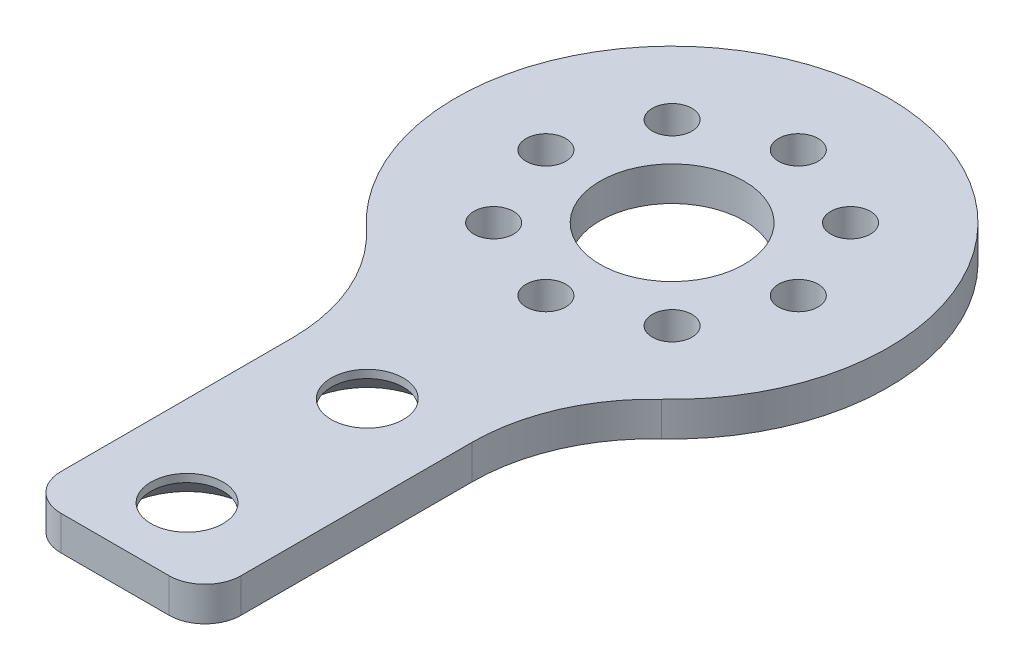
from build123d import *

# Parameters (mm, degrees)
BOSS_EXTRUDE1_DEPTH                            = 4.7625
M5_CLEARANCE_HOLE1_D                           = 5.5
M5_CLEARANCE_HOLE1_CSINK_D                     = 5.55
M5_CLEARANCE_HOLE1_CSINK_ANGLE                 = 90
SKETCH5_R                                      = 10
CUT_EXTRUDE1_DEPTH                             = 84.027763037
CSK_FOR_M8_FLAT_HEAD_MACHINE_SCREW1_AT_2_COUNT = 2
CSK_FOR_M8_FLAT_HEAD_MACHINE_SCREW1_AT_2_PITCH = 25
FILLET1_R                                      = 25
FILLET2_R                                      = 5


with BuildPart() as part:
    # Sketch1 → Boss-Extrude1 (new body)
    with BuildSketch(Plane(origin=(0, 0, 0), x_dir=(1, 0, 0), z_dir=(0, 1, 0))):
        with BuildLine():
            Line((-12.5, -77.271780287), (12.5, -77.271780287))
            Line((12.5, -77.271780287), (12.5, -27.271780287))
            ThreePointArc((12.5, -27.271780287), (0, 30), (-12.5, -27.271780287))
            Line((-12.5, -27.271780287), (-12.5, -77.271780287))
        make_face()
    extrude(amount=BOSS_EXTRUDE1_DEPTH)

    # M5 Clearance Hole1 (through all)
    with Locations(Plane(origin=(0, 0, 0), x_dir=(-1, 0, 0), z_dir=(0, -1, 0))):
        with Locations((0, 17.5), (12.374368671, 12.374368671), (17.5, 0), (12.374368671, -12.374368671), (0, -17.5), (-12.374368671, -12.374368671), (-17.5, 0), (-12.374368671, 12.374368671)):
            CounterSinkHole(M5_CLEARANCE_HOLE1_D / 2, M5_CLEARANCE_HOLE1_CSINK_D / 2, counter_sink_angle=M5_CLEARANCE_HOLE1_CSINK_ANGLE)

    # Sketch5 → Cut-Extrude1 (cut, through all)
    with BuildSketch(Plane.XZ):
        Circle(SKETCH5_R)
    extrude(amount=-CUT_EXTRUDE1_DEPTH, mode=Mode.SUBTRACT)

    # Sketch8 → CSK for M8 Flat Head Machine Screw1 (revolve, cut)
    with BuildSketch(Plane(origin=(0, 0, 42.271780287), x_dir=(0, 0, -1), z_dir=(1, 0, 0))):
        Polygon((0, 0), (0, 4.7625), (5, 4.7625), (5, 3.65), (8.65, 0), align=None)
    csk_for_m8_flat_head_machine_screw1 = revolve(axis=Axis((0, -6.35, 42.271780287), (0, 1, 0)), mode=Mode.SUBTRACT)

    # CSK for M8 Flat Head Machine Screw1 at 2: CSK for M8 Flat Head Machine Screw1 ×2
    with Locations(*[(0, 0, i * CSK_FOR_M8_FLAT_HEAD_MACHINE_SCREW1_AT_2_PITCH) for i in range(1, CSK_FOR_M8_FLAT_HEAD_MACHINE_SCREW1_AT_2_COUNT)]):
        add(csk_for_m8_flat_head_machine_screw1, mode=Mode.SUBTRACT)

    # Fillet1
    fillet1_edges = [part.edges().sort_by_distance(p)[0] for p in [
        (-12.5, 2.38125, 27.271780287),
        (12.5, 2.38125, 27.271780287),
    ]]
    fillet(fillet1_edges, radius=FILLET1_R)

    # Fillet2
    fillet2_edges = [part.edges().sort_by_distance(p)[0] for p in [
        (12.5, 2.38125, 77.271780287),
        (-12.5, 2.38125, 77.271780287),
    ]]
    fillet(fillet2_edges, radius=FILLET2_R)


solid = part.part
